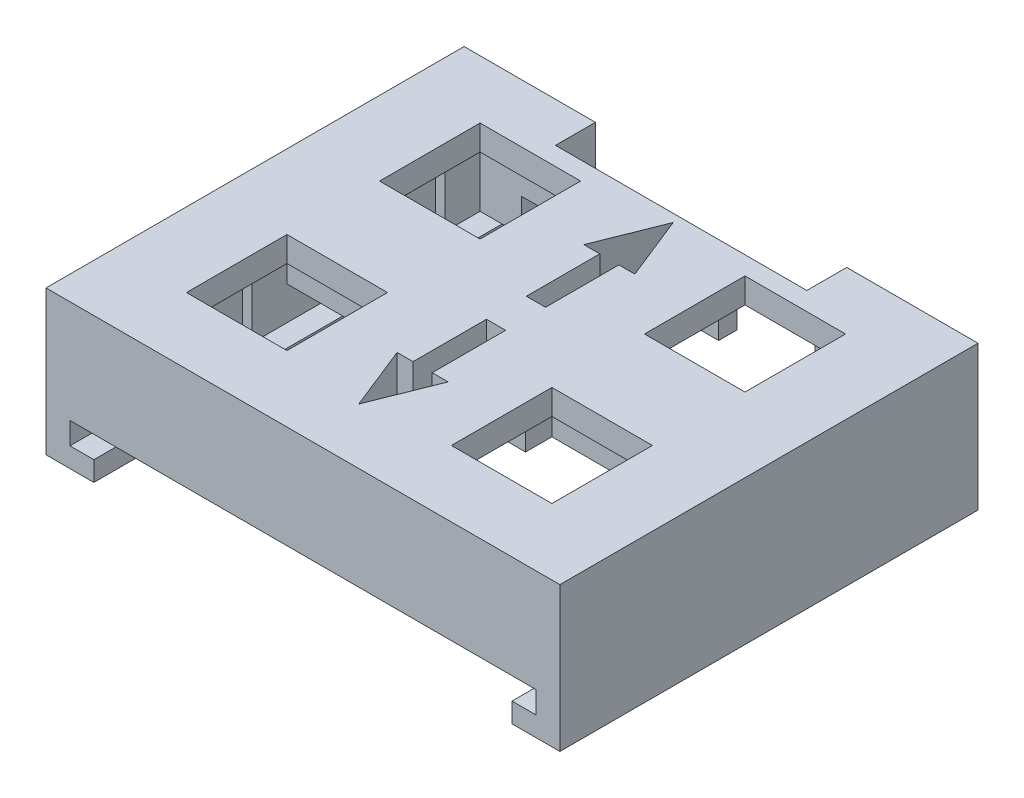
from build123d import *

# Parameters (mm, degrees)
SKETCH1_W               = 64.75
SKETCH1_H               = 84.325
SKETCH1_R               = 1.35
BOSS_EXTRUDE1_DEPTH     = 25.4
CUT_EXTRUDE1_DEPTH      = 82.335102547
SKETCH5_W               = 58.925
SKETCH5_H               = 20.6375
CUT_EXTRUDE3_DEPTH      = 82.335102547
BOSS_EXTRUDE2_START     = 4.7625
SKETCH1_3_W             = 6.75
SKETCH1_3_H             = 6.75
SKETCH1_3_R             = 1.35
SKETCH1_3_H_2           = 3.175
BOSS_EXTRUDE2_DEPTH     = 9.525
CUT_EXTRUDE6_DEPTH      = 55.65443286
CUT_EXTRUDE6_DEPTH_BACK = 55.65443286
SKETCH7_W               = 26.65
SKETCH7_H               = 62.1
SKETCH8_W               = 40.894
SKETCH8_H               = 33.274
SKETCH8_W_2             = 8
SKETCH8_H_2             = 8
BOSS_EXTRUDE3_DEPTH     = 11.5
SKETCH8_3_W             = 8
SKETCH8_3_H             = 8
CUT_EXTRUDE7_DEPTH      = 9.5
CUT_EXTRUDE8_DEPTH      = 6
SKETCH9_W               = 26.65
SKETCH9_H               = 86.865
CUT_EXTRUDE9_DEPTH      = 6
CUT_EXTRUDE10_DEPTH     = 84.258730216
SKETCH11_W              = 64.75
SKETCH11_H              = 84.325
CUT_EXTRUDE11_DEPTH     = 86.930007316
BOSS_EXTRUDE4_DEPTH     = 40.894
SKETCH15_W              = 7.376
SKETCH15_H              = 9.883286215
SKETCH15_W_2            = 20
SKETCH15_H_2            = 9.293713785
CUT_EXTRUDE12_DEPTH     = 79.999970514
CUT_EXTRUDE14_START     = -33.274
CUT_EXTRUDE14_DEPTH     = 80.122835409
FILLET1_R               = 3.175
FILLET2_R               = 2.54
SKETCH22_W              = 9.202496002
SKETCH22_H              = 15.787790907
CUT_EXTRUDE17_DEPTH     = 87.575023929


with BuildPart() as part:
    # Sketch1 → Boss-Extrude1 (new body)
    with BuildSketch(Plane(origin=(0, 0, 0), x_dir=(1, 0, 0), z_dir=(0, 1, 0))):
        Rectangle(SKETCH1_W, SKETCH1_H)
        with Locations(Location((-29, 10.2125, 0), (0, 0, 270))):
            Circle(SKETCH1_R, mode=Mode.SUBTRACT)
        with Locations(Location((29, 10.2125, 0), (0, 0, 270))):
            Circle(SKETCH1_R, mode=Mode.SUBTRACT)
        with Locations(Location((-29, -38.7875, 0), (0, 0, 270))):
            Circle(SKETCH1_R, mode=Mode.SUBTRACT)
        with Locations(Location((29, -38.7875, 0), (0, 0, 270))):
            Circle(SKETCH1_R, mode=Mode.SUBTRACT)
    extrude(amount=BOSS_EXTRUDE1_DEPTH)

    # Sketch3 → Cut-Extrude1 (cut, through all)
    with BuildSketch(Plane(origin=(32.375, 0, 0), x_dir=(0, 0, -1), z_dir=(1, 0, 0))):
        Polygon((42.1625, 18.034), (23.1125, 18.669), (23.1125, 12.7), (42.1625, 12.7), align=None)
    extrude(amount=-CUT_EXTRUDE1_DEPTH, mode=Mode.SUBTRACT)

    # Sketch5 → Cut-Extrude3 (cut, through all)
    with BuildSketch(Plane(origin=(32.375, 0, 0), x_dir=(0, 0, -1), z_dir=(1, 0, 0))):
        with Locations((-12.7, 15.08125)):
            Rectangle(SKETCH5_W, SKETCH5_H)
    extrude(amount=-CUT_EXTRUDE3_DEPTH, mode=Mode.SUBTRACT)

    # Sketch1<3> → Boss-Extrude2 (add)
    # profile 1 of 6: a face of its own
    with BuildSketch(Plane(origin=(0, 0, 0), x_dir=(1, 0, 0), z_dir=(0, 1, 0)).offset(BOSS_EXTRUDE2_START)):
        with Locations((29, -38.7875)):
            Rectangle(SKETCH1_3_W, SKETCH1_3_H)
        with Locations(Location((29, -38.7875, 0), (0, 0, 90))):
            Circle(SKETCH1_3_R, mode=Mode.SUBTRACT)
    # profile 2 of 6: a face of its own
    with BuildSketch(Plane(origin=(0, 0, 0), x_dir=(1, 0, 0), z_dir=(0, 1, 0)).offset(BOSS_EXTRUDE2_START)):
        with Locations((-29, -38.7875)):
            Rectangle(SKETCH1_3_W, SKETCH1_3_H)
        with Locations(Location((-29, -38.7875, 0), (0, 0, 90))):
            Circle(SKETCH1_3_R, mode=Mode.SUBTRACT)
    # profile 3 of 6: a face of its own
    with BuildSketch(Plane(origin=(0, 0, 0), x_dir=(1, 0, 0), z_dir=(0, 1, 0)).offset(BOSS_EXTRUDE2_START)):
        with Locations((-29, 10.2125)):
            Rectangle(SKETCH1_3_W, SKETCH1_3_H)
        with Locations(Location((-29, 10.2125, 0), (0, 0, 90))):
            Circle(SKETCH1_3_R, mode=Mode.SUBTRACT)
    # profile 4 of 6: a face of its own
    with BuildSketch(Plane(origin=(0, 0, 0), x_dir=(1, 0, 0), z_dir=(0, 1, 0)).offset(BOSS_EXTRUDE2_START)):
        with Locations((29, 10.2125)):
            Rectangle(SKETCH1_3_W, SKETCH1_3_H)
        with Locations(Location((29, 10.2125, 0), (0, 0, 90))):
            Circle(SKETCH1_3_R, mode=Mode.SUBTRACT)
    # profile 5 of 6: a face of its own
    with BuildSketch(Plane(origin=(0, 0, 0), x_dir=(1, 0, 0), z_dir=(0, 1, 0)).offset(BOSS_EXTRUDE2_START)):
        with Locations((-29, 15.175)):
            Rectangle(SKETCH1_3_W, SKETCH1_3_H_2)
    # profile 6 of 6: a face of its own
    with BuildSketch(Plane(origin=(0, 0, 0), x_dir=(1, 0, 0), z_dir=(0, 1, 0)).offset(BOSS_EXTRUDE2_START)):
        with Locations((29, 15.175)):
            Rectangle(SKETCH1_3_W, SKETCH1_3_H_2)
    extrude(amount=BOSS_EXTRUDE2_DEPTH)

    # Sketch7 → Cut-Extrude6 (cut, two sides: drawn at the far end of the back side and taken through both)
    with BuildSketch(Plane(origin=(0, 12.7, 0), x_dir=(1, 0, 0), z_dir=(0, 1, 0)).offset(-CUT_EXTRUDE6_DEPTH_BACK)):
        with Locations((0, -1.5875)):
            Rectangle(SKETCH7_W, SKETCH7_H)
    extrude(amount=CUT_EXTRUDE6_DEPTH + CUT_EXTRUDE6_DEPTH_BACK, mode=Mode.SUBTRACT)

    # Sketch8 → Boss-Extrude3 (add)
    with BuildSketch(Plane.XZ):
        with Locations((0, 58.7995)):
            Rectangle(SKETCH8_W, SKETCH8_H)
        with Locations((-10.541, 50.7985)):
            Rectangle(SKETCH8_W_2, SKETCH8_H_2, mode=Mode.SUBTRACT)
        with Locations((10.541, 50.7985)):
            Rectangle(SKETCH8_W_2, SKETCH8_H_2, mode=Mode.SUBTRACT)
        with Locations((-10.541, 66.1655)):
            Rectangle(SKETCH8_W_2, SKETCH8_H_2, mode=Mode.SUBTRACT)
        with Locations((10.541, 66.1655)):
            Rectangle(SKETCH8_W_2, SKETCH8_H_2, mode=Mode.SUBTRACT)
    extrude(amount=-BOSS_EXTRUDE3_DEPTH)

    # Sketch8<3> → Cut-Extrude7 (cut)
    # profile 1 of 4: a face of its own
    with BuildSketch(Plane.XZ):
        Polygon((-16.637, 47.4965), (-16.637, 44.7025), (-4.445, 44.7025), (-4.445, 46.7984953), (-2.8575, 46.7984953), (-2.8575, 54.7985047), (-4.445, 54.7985047), (-4.445, 56.8945), (-16.637, 56.8945), (-16.637, 54.1005), (-17.399, 54.1005), (-17.399, 47.4965), align=None)
        with Locations((-10.541, 50.7985)):
            Rectangle(SKETCH8_3_W, SKETCH8_3_H, mode=Mode.SUBTRACT)
    # profile 2 of 4: a face of its own
    with BuildSketch(Plane.XZ):
        Polygon((4.445, 56.8945), (4.445, 54.7985047), (2.8575, 54.7985047), (2.8575, 46.7984953), (4.445, 46.7984953), (4.445, 44.7025), (16.637, 44.7025), (16.637, 47.4965), (17.399, 47.4965), (17.399, 54.1005), (16.637, 54.1005), (16.637, 56.8945), align=None)
        with Locations((10.541, 50.7985)):
            Rectangle(SKETCH8_3_W, SKETCH8_3_H, mode=Mode.SUBTRACT)
    # profile 3 of 4: a face of its own
    with BuildSketch(Plane.XZ):
        Polygon((-16.637, 72.2615), (-16.637, 69.4675), (-17.399, 69.4675), (-17.399, 62.8635), (-16.637, 62.8635), (-16.637, 60.0695), (-4.445, 60.0695), (-4.445, 62.1654953), (-2.8575, 62.1654953), (-2.8575, 70.1655047), (-4.445, 70.1655047), (-4.445, 72.2615), align=None)
        with Locations((-10.541, 66.1655)):
            Rectangle(SKETCH8_3_W, SKETCH8_3_H, mode=Mode.SUBTRACT)
    # profile 4 of 4: a face of its own
    with BuildSketch(Plane.XZ):
        Polygon((4.445, 72.2615), (4.445, 70.1655047), (2.8575, 70.1655047), (2.8575, 62.1654953), (4.445, 62.1654953), (4.445, 60.0695), (16.637, 60.0695), (16.637, 62.8635), (17.399, 62.8635), (17.399, 69.4675), (16.637, 69.4675), (16.637, 72.2615), align=None)
        with Locations((10.541, 66.1655)):
            Rectangle(SKETCH8_3_W, SKETCH8_3_H, mode=Mode.SUBTRACT)
    extrude(amount=-CUT_EXTRUDE7_DEPTH, mode=Mode.SUBTRACT)

    # Sketch8<4> → Cut-Extrude8 (cut)
    with BuildSketch(Plane.XZ):
        Polygon((-4.445, 46.7984953), (-4.445, 44.7025), (4.445, 44.7025), (4.445, 46.7984953), (2.8575, 46.7984953), (2.8575, 54.7985047), (4.445, 54.7985047), (4.445, 56.8945), (16.637, 56.8945), (16.637, 60.0695), (4.445, 60.0695), (4.445, 62.1654953), (2.8575, 62.1654953), (2.8575, 70.1655047), (4.445, 70.1655047), (4.445, 72.2615), (-4.445, 72.2615), (-4.445, 70.1655047), (-2.8575, 70.1655047), (-2.8575, 62.1654953), (-4.445, 62.1654953), (-4.445, 60.0695), (-16.637, 60.0695), (-16.637, 56.8945), (-4.445, 56.8945), (-4.445, 54.7985047), (-2.8575, 54.7985047), (-2.8575, 46.7984953), align=None)
    extrude(amount=-CUT_EXTRUDE8_DEPTH, mode=Mode.SUBTRACT)

    # Sketch9 → Cut-Extrude9 (cut)
    with BuildSketch(Plane.XZ):
        with Locations((0, 1.27)):
            Rectangle(SKETCH9_W, SKETCH9_H)
    extrude(amount=-CUT_EXTRUDE9_DEPTH, mode=Mode.SUBTRACT)

    # Sketch10 → Cut-Extrude10 (cut, through all)
    with BuildSketch(Plane(origin=(0, 11.5, 0), x_dir=(1, 0, 0), z_dir=(0, 1, 0))):
        Polygon((-0.762, -56.8945), (0.762, -56.8945), (0.762, -51.0525), (2.032, -51.0525), (0, -45.9725), (-2.032, -51.0525), (-0.762, -51.0525), align=None)
        Polygon((-0.762, -65.9115), (-0.762, -60.0695), (0.762, -60.0695), (0.762, -65.9115), (2.032, -65.9115), (0, -70.9915), (-2.032, -65.9115), align=None)
    extrude(amount=-CUT_EXTRUDE10_DEPTH, mode=Mode.SUBTRACT)

    # Sketch11 → Cut-Extrude11 (cut, through all)
    with BuildSketch(Plane.XZ):
        Rectangle(SKETCH11_W, SKETCH11_H)
    extrude(amount=-CUT_EXTRUDE11_DEPTH, mode=Mode.SUBTRACT)

    # Sketch14 → Boss-Extrude4 (add)
    with BuildSketch(Plane(origin=(20.447, 0, 0), x_dir=(0, 0, -1), z_dir=(1, 0, 0))):
        with BuildLine():
            Line((-38.942699076, 7.350099538), (-39.3685, 2.3))
            Line((-39.3685, 2.3), (-36.819487459, 2.3))
            Line((-36.819487459, 2.3), (-36.043786215, 11.5))
            Line((-36.043786215, 11.5), (-42.1625, 11.5))
            Line((-42.1625, 11.5), (-42.1625, 7.350099538))
            ThreePointArc((-42.1625, 7.350099538), (-40.552599538, 8.96), (-38.942699076, 7.350099538))
        make_face()
    extrude(amount=-BOSS_EXTRUDE4_DEPTH)

    # Sketch15 → Cut-Extrude12 (cut, through all)
    with BuildSketch(Plane(origin=(0, 11.5, 0), x_dir=(1, 0, 0), z_dir=(0, 1, 0))):
        with Locations((16.759, -31.102143108)):
            Rectangle(SKETCH15_W, SKETCH15_H)
        with Locations((-16.759, -31.102143108)):
            Rectangle(SKETCH15_W, SKETCH15_H)
        with Locations((0, -40.690643108)):
            Rectangle(SKETCH15_W_2, SKETCH15_H_2)
        with Locations((0, -40.690643108)):
            Rectangle(SKETCH15_W_2, SKETCH15_H_2)
    extrude(amount=-CUT_EXTRUDE12_DEPTH, mode=Mode.SUBTRACT)

    # Sketch18 → Cut-Extrude14 (cut, through all)
    with BuildSketch(Plane.XY.offset(75.4365).offset(CUT_EXTRUDE14_START)):
        Polygon((18.542, 1.569), (18.542, 3.319), (-18.542, 3.319), (-18.542, 1.569), (-16.637, 1.569), (-16.637, 0), (16.637, 0), (16.637, 1.569), align=None)
    extrude(amount=CUT_EXTRUDE14_DEPTH, mode=Mode.SUBTRACT)

    # Fillet1
    fillet1_edges = [part.edges().sort_by_distance(p)[0] for p in [
        (-15.2235, 11.5, 36.043786215),
        (15.2235, 11.5, 36.043786215),
    ]]
    fillet(fillet1_edges, radius=FILLET1_R)

    # Fillet2
    # the kernel refuses this fillet: 2.54 mm, written as the material it takes off along each edge
    with BuildSketch(Plane(origin=(-3.11459751, 2.3, 39.3685), x_dir=(0, 0, -1), z_dir=(-1, 0, 0)), Plane(origin=(27.33240249, 2.3, 39.3685), x_dir=(0, 0, -1), z_dir=(-1, 0, 0))) as fillet2_piece_1:
        with BuildLine():
            CenterArc((2.762416328, -2.531019325), FILLET2_R, 94.819514659, 90)
            Line((0.231397003, -2.744423112), (0.180776616, -2.748691188))
            Line((0.180776616, -2.748691188), (-0.050620387, -0.004268076))
            Line((-0.050620387, -0.004268076), (0, 0.0508))
            ThreePointArc((0, 0.0508), (1.27450627, 0.0508), (2.544744465, 0.050620387))
            Line((2.544744465, 0.050620387), (2.549012541, 0))
        make_face()
    extrude(amount=24.217804979, mode=Mode.SUBTRACT)

    # Sketch22 → Cut-Extrude17 (cut, through all)
    with BuildSketch(Plane.ZY.offset(20.447)):
        with Locations((37.561251999, 7.893895454)):
            Rectangle(SKETCH22_W, SKETCH22_H)
    extrude(amount=-CUT_EXTRUDE17_DEPTH, mode=Mode.SUBTRACT)


solid = part.part
